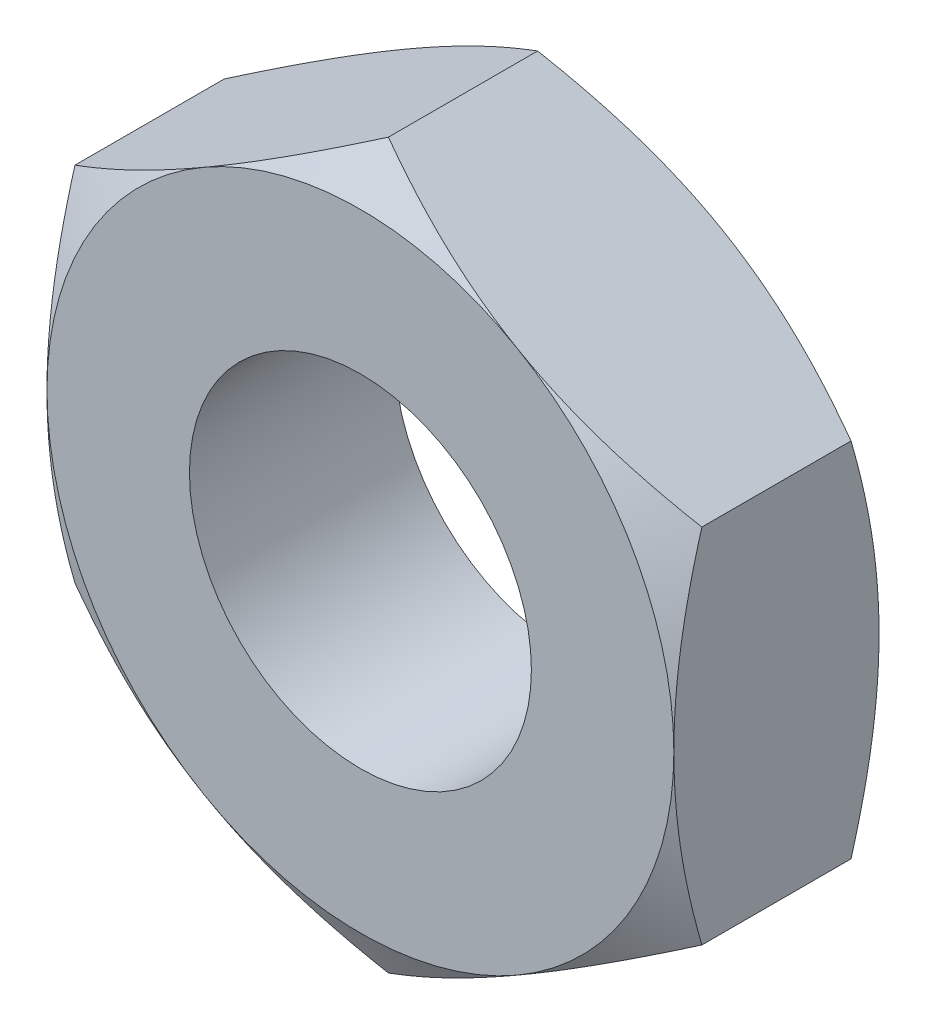
from build123d import *

# Parameters (mm, degrees)
BASE_EXTRUSION_DEPTH   = 1.8
BOSS_EXTRU_1_START     = -1.8
BOSS_EXTRU_1_OUTLINE_R = 1.5
BOSS_EXTRU_1_DEPTH     = 1.8


# Read off the part's stored shape, not the designer's step: Boss.-Extru.1
with BuildPart() as part:
    # Esquisse1 → Base-Extrusion (new body)
    with BuildSketch(Plane.XY):
        Polygon((2.75, -1.58771324), (2.75, 1.58771324), (0, 3.175426481), (-2.75, 1.58771324), (-2.75, -1.58771324), (0, -3.175426481), align=None)
    extrude(amount=-BASE_EXTRUSION_DEPTH)

    # Esquisse2 → Enlèvement de matière-Révolution1 (revolve, cut)
    with BuildSketch(Plane(origin=(0, 0, 0), x_dir=(1, 0, 0), z_dir=(0, 1, 0))):
        Polygon((-2.75, 0), (-5.308845727, 0), (-5.308845727, 1.8), (-2.75, 1.8), (-4.308845727, 0.9), align=None)
    revolve(axis=Axis((0, 0, -1.8), (0, 0, 1)), mode=Mode.SUBTRACT)

    # Boss.-Extru.1 outline → Boss.-Extru.1 (cut)
    with BuildSketch(Plane.XY.offset(BOSS_EXTRU_1_START)):
        Circle(BOSS_EXTRU_1_OUTLINE_R)
    extrude(amount=BOSS_EXTRU_1_DEPTH, mode=Mode.SUBTRACT)


solid = part.part
